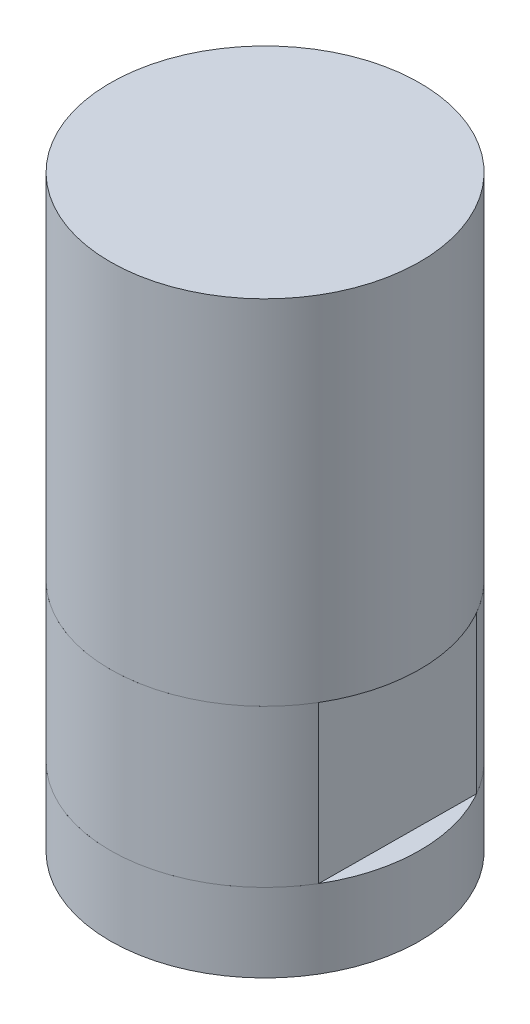
from build123d import *

# Parameters (mm, degrees)
SKETCH1_R           = 3.95
BOSS_EXTRUDE1_DEPTH = 2
BOSS_EXTRUDE2_DEPTH = 4
SKETCH4_R           = 3.95
BOSS_EXTRUDE3_DEPTH = 2
CUT_EXTRUDE1_DEPTH  = 10.757304956
SKETCH6_R           = 3.95
BOSS_EXTRUDE4_DEPTH = 7


with BuildPart() as part:
    # Sketch1 → Boss-Extrude1 (new body)
    with BuildSketch(Plane(origin=(0, 0, 0), x_dir=(1, 0, 0), z_dir=(0, 1, 0))):
        Circle(SKETCH1_R)
    extrude(amount=BOSS_EXTRUDE1_DEPTH)


with BuildPart() as body_2:
    # Sketch3 → Boss-Extrude2 (new body)
    with BuildSketch(Plane(origin=(0, 2, 0), x_dir=(1, 0, 0), z_dir=(0, 1, 0))):
        with BuildLine():
            Line((-2.025641026, 3.391058601), (1.974358974, 3.421170361))
            ThreePointArc((1.974358974, 3.421170361), (2.793071786, 2.793071786), (3.421170361, 1.974358974))
            Line((3.421170361, 1.974358974), (3.391058601, -2.025641026))
            ThreePointArc((3.391058601, -2.025641026), (-2.793071786, -2.793071786), (-2.025641026, 3.391058601))
        make_face()
    extrude(amount=BOSS_EXTRUDE2_DEPTH)


with BuildPart() as body_3:
    # Sketch4 → Boss-Extrude3 (new body)
    with BuildSketch(Plane(origin=(0, 6, 0), x_dir=(1, 0, 0), z_dir=(0, 1, 0))):
        Circle(SKETCH4_R)
    extrude(amount=BOSS_EXTRUDE3_DEPTH)


with BuildPart() as cut_extrude1_tool:
    # Sketch5 → Cut-Extrude1 (new, through all)
    with BuildSketch(Plane(origin=(0, 8, 0), x_dir=(1, 0, 0), z_dir=(0, 1, 0))):
        with BuildLine():
            Line((1.676190476, 1.424915958), (1.676190476, -1.424915958))
            ThreePointArc((1.676190476, -1.424915958), (-2.2, 0), (1.676190476, 1.424915958))
        make_face()
    extrude(amount=-CUT_EXTRUDE1_DEPTH)


with BuildPart() as part_1:
    add(part.part)

    # Cut-Extrude1: cut by cut_extrude1_tool
    add(cut_extrude1_tool.part, mode=Mode.SUBTRACT)


with BuildPart() as body_2_1:
    add(body_2.part)

    # Cut-Extrude1: cut by cut_extrude1_tool
    add(cut_extrude1_tool.part, mode=Mode.SUBTRACT)


with BuildPart() as body_3_1:
    add(body_3.part)

    # Cut-Extrude1: cut by cut_extrude1_tool
    add(cut_extrude1_tool.part, mode=Mode.SUBTRACT)

    # Sketch6 → Boss-Extrude4 (add)
    with BuildSketch(Plane(origin=(0, 8, 0), x_dir=(1, 0, 0), z_dir=(0, 1, 0))):
        Circle(SKETCH6_R)
    extrude(amount=BOSS_EXTRUDE4_DEPTH)


solid = Compound([part_1.part, body_2_1.part, body_3_1.part])
